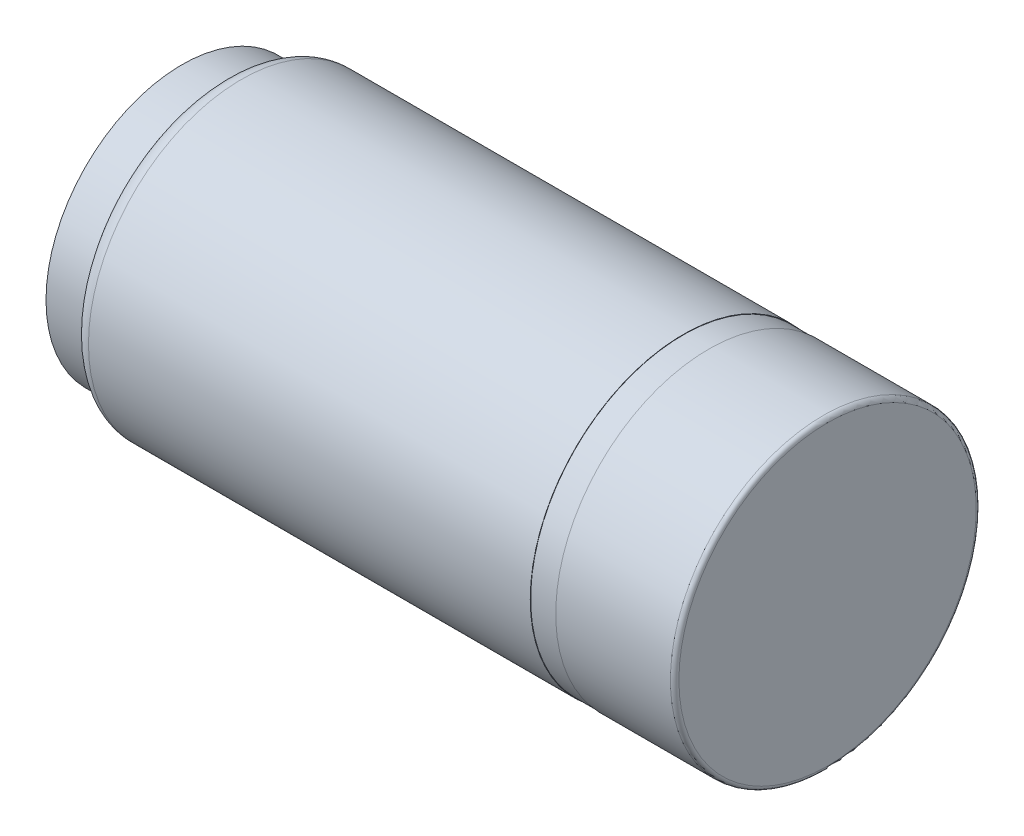
from build123d import *

# Parameters (mm, degrees)
SKETCH_1_W               = 16.3
SKETCH_1_H               = 3
SKETCH_1_W_2             = 5
SKETCH_1_H_2             = 16
SKETCH_19_W              = 3
SKETCH_19_H              = 0.05
EXTRUDE_START            = 14
SKETCH_20_R              = 18
EXTRUDE_2_DEPTH          = 14
CUT_EXTRUDE_6_DEPTH      = 3
CUT_EXTRUDE_4_DEPTH      = 12
SKETCH_13_R              = 1.5
CUT_EXTRUDE_8_DEPTH      = 7
PATTERN_CIRCULAR_2_COUNT = 4
FILLET_1_R               = 0.5
SKETCH_21_R              = 20
CUT_EXTRUDE_7_DEPTH      = 42.3


with BuildPart() as part:
    # Эскиз1 → Повернуть1 основной корпус (revolve)
    with BuildSketch(Plane(origin=(0, 0, 0), x_dir=(1, 0, 0), z_dir=(0, 1, 0)), mode=Mode.PRIVATE) as revolve_1_sk:
        with Locations((8.15, 1.5)):
            Rectangle(SKETCH_1_W, SKETCH_1_H)
        Polygon((16.3, 0), (19.3, 0), (19.3, 10), (16.3, 10), (16.3, 3), align=None)
        Polygon((24.3, 0), (24.3, 16), (20.3, 16), (19.3, 15), (19.3, 10), (19.3, 0), align=None)
        Polygon((40.8, 17.5), (42.3, 16), (42.3, 0), (24.3, 0), (24.3, 16), (25.8, 17.5), align=None)
        with Locations((44.8, 8)):
            Rectangle(SKETCH_1_W_2, SKETCH_1_H_2)
        with BuildLine():
            ThreePointArc((47.3, 16), (47.885786438, 17.414213562), (49.3, 18))
            Line((49.3, 18), (104.3, 18))
            Line((104.3, 18), (104.3, 0))
            Line((104.3, 0), (47.3, 0))
            Line((47.3, 0), (47.3, 16))
        make_face()
    revolve(revolve_1_sk.sketch.rotate(Axis((0, 0, 0), (1, 0, 0)), 180), axis=Axis((0, 0, 0), (1, 0, 0)))

    # Эскиз19 → Вырез-Повернуть2 пластиковая часть (revolve, cut)
    with BuildSketch(Plane(origin=(0, 0, 0), x_dir=(1, 0, 0), z_dir=(0, 1, 0)), mode=Mode.PRIVATE) as cut_revolve_2_sk:
        with Locations((102.8, 17.975)):
            Rectangle(SKETCH_19_W, SKETCH_19_H)
    revolve(cut_revolve_2_sk.sketch.rotate(Axis((103.004702911, 0, 0), (-1, 0, 0)), 180), axis=Axis((103.004702911, 0, 0), (-1, 0, 0)), mode=Mode.SUBTRACT)

    # Эскиз20 → Бобышка-Вытянуть2 пластиковая крышка контактов (add)
    with BuildSketch(Plane(origin=(104.3, 0, 0), x_dir=(0, 0, -1), z_dir=(1, 0, 0)).offset(EXTRUDE_START)):
        with Locations(Location((0, 0, 0), (0, 0, 180))):
            Circle(SKETCH_20_R)
    extrude(amount=-EXTRUDE_2_DEPTH)

    # Эскиз11 → Вырез-Вытянуть6 (cut)
    with BuildSketch(Plane.ZY.offset(-16.3)):
        with BuildLine():
            ThreePointArc((4.358898944, 9), (0, 10), (-4.358898944, 9))
            Line((-4.358898944, 9), (4.358898944, 9))
        make_face()
        with BuildLine():
            Line((4.358898944, -9), (-4.358898944, -9))
            ThreePointArc((-4.358898944, -9), (0, -10), (4.358898944, -9))
        make_face()
    extrude(amount=-CUT_EXTRUDE_6_DEPTH, mode=Mode.SUBTRACT)

    # Эскиз6 → Вырез-Вытянуть4 на оси (cut)
    with BuildSketch(Plane.ZY):
        with BuildLine():
            Line((-1.75306936, 2.434491286), (1.561110291, 2.561822527))
            ThreePointArc((1.561110291, 2.561822527), (-0.115175441, 2.997788288), (-1.75306936, 2.434491286))
        make_face()
    extrude(amount=-CUT_EXTRUDE_4_DEPTH, mode=Mode.SUBTRACT)

    # Эскиз13 → Вырез-Вытянуть8 для винтов (cut)
    with BuildSketch(Plane.ZY.offset(-19.3)):
        with Locations((-9.192388155, 9.192388155)):
            Circle(SKETCH_13_R)
    cut_extrude_8 = extrude(amount=-CUT_EXTRUDE_8_DEPTH, mode=Mode.SUBTRACT)

    # Круговой массив2 для винтов: Вырез-Вытянуть8 для винтов ×4 about axis
    pattern_circular_2_axis = Axis((0, 0, 0), (1, 0, 0))
    for i in range(1, PATTERN_CIRCULAR_2_COUNT):
        add(cut_extrude_8.rotate(pattern_circular_2_axis, i * 360 / PATTERN_CIRCULAR_2_COUNT), mode=Mode.SUBTRACT)

    # Скругление1
    # the kernel refuses this fillet: 0.5 mm, written as the material it takes off along each edge
    with BuildSketch(Plane(origin=(19.3, 0, 0), x_dir=(0, 0, 1), z_dir=(0, 1, 0))) as fillet_1_piece_1:
        with BuildLine():
            CenterArc((15 - FILLET_1_R * 0.414213562373, FILLET_1_R), FILLET_1_R, 270, 45)
            Line((15 - FILLET_1_R * 0.414213562373, 0), (15, 0))
            Line((15, 0), (15 + FILLET_1_R * 0.292893218813, FILLET_1_R * 0.292893218813))
        make_face()
    revolve(axis=Axis((19.3, 0, 0), (1, 0, 0)), mode=Mode.SUBTRACT)
    with BuildSketch(Plane(origin=(118.3, 0, 0), x_dir=(0, 0, 1), z_dir=(0, 1, 0))) as fillet_1_piece_2:
        with BuildLine():
            CenterArc((18 - FILLET_1_R, -FILLET_1_R), FILLET_1_R, 0, 90)
            Line((18 - FILLET_1_R, 0), (18, 0))
            Line((18, 0), (18, -FILLET_1_R))
        make_face()
    revolve(axis=Axis((118.3, 0, 0), (1, 0, 0)), mode=Mode.SUBTRACT)
    with BuildSketch(Plane(origin=(16.001803864, 9, -4.358898944), x_dir=(0, 0, 1), z_dir=(1, 0, 0))) as fillet_1_piece_3:
        with BuildLine():
            CenterArc((0.116258256, 0.5), FILLET_1_R, 243.474647983, 26.525352017)
            ThreePointArc((-0.107038622, 0.052631579), (-0.053597784, 0.026156196), (0, 0))
            Line((0, 0), (0.116258256, 0))
        make_face()
    extrude(amount=3.298196136, mode=Mode.SUBTRACT)
    with BuildSketch(Plane(origin=(16.001803864, 9, 4.358898944), x_dir=(0, -0.4412496727830022, 0.8973843804462464), z_dir=(1, 0, 0))) as fillet_1_piece_4:
        with BuildLine():
            CenterArc((0.116296493, 0.499991108), FILLET_1_R, 243.81635761, 26.525352017)
            Line((-0.104328343, 0.051298918), (0, 0))
            ThreePointArc((0, 0), (0.059639227, -0.000177843), (0.119278454, 0))
        make_face()
    extrude(amount=3.298196136, mode=Mode.SUBTRACT)
    with BuildSketch(Plane(origin=(16.3, 9, -5.608898944), x_dir=(1, 0, 0), z_dir=(0, 0, 1)), Plane(origin=(16.3, -9, 5.608898944), x_dir=(1, 0, 0), z_dir=(0, 0, -1))) as fillet_1_piece_5:
        with BuildLine():
            CenterArc((FILLET_1_R, -FILLET_1_R), FILLET_1_R, 90, 90)
            Line((0, -FILLET_1_R), (0, 0))
            Line((0, 0), (FILLET_1_R, 0))
        make_face()
    extrude(amount=11.217797887, mode=Mode.SUBTRACT)
    with BuildSketch(Plane(origin=(16.001803864, -9, 4.358898944), x_dir=(0, 0.4412496727830018, 0.8973843804462466), z_dir=(1, 0, 0))) as fillet_1_piece_6:
        with BuildLine():
            CenterArc((0.116296493, -0.499991108), FILLET_1_R, 89.658290373, 26.525352017)
            Line((-0.104328343, -0.051298918), (0, 0))
            ThreePointArc((0, 0), (0.059639227, 0.000177843), (0.119278454, 0))
        make_face()
    extrude(amount=3.298196136, mode=Mode.SUBTRACT)
    with BuildSketch(Plane(origin=(16.001803864, -9, -4.358898944), x_dir=(0, 0, 1), z_dir=(1, 0, 0))) as fillet_1_piece_7:
        with BuildLine():
            CenterArc((0.116258256, -0.5), FILLET_1_R, 90, 26.525352017)
            ThreePointArc((-0.107038622, -0.052631579), (-0.053597784, -0.026156196), (0, 0))
            Line((0, 0), (0.116258256, 0))
        make_face()
    extrude(amount=3.298196136, mode=Mode.SUBTRACT)
    with BuildSketch(Plane(origin=(19.3, 9.192388155, -9.192388155), x_dir=(0, 0, 1), z_dir=(0, -1, 0))) as fillet_1_piece_8:
        with BuildLine():
            CenterArc((1.5 + FILLET_1_R, -FILLET_1_R), FILLET_1_R, 90, 90)
            Line((1.5, -FILLET_1_R), (1.5, 0))
            Line((1.5, 0), (1.5 + FILLET_1_R, 0))
        make_face()
    revolve(axis=Axis((19.3, 9.192388155, -9.192388155), (-1, 0, 0)), mode=Mode.SUBTRACT)
    with BuildSketch(Plane(origin=(19.3, -9.192388155, -9.192388155), x_dir=(0, 1, 0), z_dir=(0, 0, 1))) as fillet_1_piece_9:
        with BuildLine():
            CenterArc((1.5 + FILLET_1_R, -FILLET_1_R), FILLET_1_R, 90, 90)
            Line((1.5, -FILLET_1_R), (1.5, 0))
            Line((1.5, 0), (1.5 + FILLET_1_R, 0))
        make_face()
    revolve(axis=Axis((19.3, -9.192388155, -9.192388155), (-1, 0, 0)), mode=Mode.SUBTRACT)
    with BuildSketch(Plane(origin=(19.3, -9.192388155, 9.192388155), x_dir=(0, 0, -1), z_dir=(0, 1, 0))) as fillet_1_piece_10:
        with BuildLine():
            CenterArc((1.5 + FILLET_1_R, -FILLET_1_R), FILLET_1_R, 90, 90)
            Line((1.5, -FILLET_1_R), (1.5, 0))
            Line((1.5, 0), (1.5 + FILLET_1_R, 0))
        make_face()
    revolve(axis=Axis((19.3, -9.192388155, 9.192388155), (-1, 0, 0)), mode=Mode.SUBTRACT)
    with BuildSketch(Plane(origin=(19.3, 9.192388155, 9.192388155), x_dir=(0, -1, 0), z_dir=(0, 0, -1))) as fillet_1_piece_11:
        with BuildLine():
            CenterArc((1.5 + FILLET_1_R, -FILLET_1_R), FILLET_1_R, 90, 90)
            Line((1.5, -FILLET_1_R), (1.5, 0))
            Line((1.5, 0), (1.5 + FILLET_1_R, 0))
        make_face()
    revolve(axis=Axis((19.3, 9.192388155, 9.192388155), (-1, 0, 0)), mode=Mode.SUBTRACT)
    # the kernel refuses this fillet: 0.5 mm, written as the material it adds along each edge
    with BuildSketch(Plane(origin=(19.3, 0, 0), x_dir=(0, -0.8947368421052432, -0.4465937565389121), z_dir=(0, -0.4465937565389121, 0.8947368421052432))) as fillet_1_2_piece_1:
        with BuildLine():
            CenterArc((10 + FILLET_1_R, -FILLET_1_R), FILLET_1_R, 90, 90)
            Line((10, -FILLET_1_R), (10, 0))
            Line((10, 0), (10 + FILLET_1_R, 0))
        make_face()
    revolve(axis=Axis((19.3, 0, 0), (1, 0, 0)), revolution_arc=126.949295967)
    with BuildSketch(Plane(origin=(19.3, 9, -4.242640687), x_dir=(0, 1, 0), z_dir=(0, 0, 1)), Plane(origin=(19.3, -9, 4.242640687), x_dir=(0, -1, 0), z_dir=(0, 0, -1))) as fillet_1_2_piece_2:
        with BuildLine():
            CenterArc((FILLET_1_R, FILLET_1_R), FILLET_1_R, 180, 90)
            Line((0, FILLET_1_R), (0, 0))
            Line((0, 0), (FILLET_1_R, 0))
        make_face()
    extrude(amount=8.485281374)
    with BuildSketch(Plane(origin=(19.3, 0, 0), x_dir=(0, 0.894736842105243, 0.44659375653891253), z_dir=(0, 0.44659375653891253, -0.894736842105243))) as fillet_1_2_piece_3:
        with BuildLine():
            CenterArc((10 + FILLET_1_R, -FILLET_1_R), FILLET_1_R, 90, 90)
            Line((10, -FILLET_1_R), (10, 0))
            Line((10, 0), (10 + FILLET_1_R, 0))
        make_face()
    revolve(axis=Axis((19.3, 0, 0), (1, 0, 0)), revolution_arc=126.949295967)
    with BuildSketch(Plane(origin=(19.3, -8.5, 4.242640687), x_dir=(0, -0.8947368421052433, 0.446593756538912), z_dir=(0, 0.446593756538912, 0.8947368421052433))) as fillet_1_2_piece_4:
        with BuildLine():
            CenterArc((0.5 + FILLET_1_R, -FILLET_1_R), FILLET_1_R, 90, 90)
            Line((0.5, -FILLET_1_R), (0.5, 0))
            Line((0.5, 0), (0.5 + FILLET_1_R, 0))
        make_face()
    revolve(axis=Axis((19.3, -8.5, 4.242640687), (1, 0, 0)), revolution_arc=26.525352017)
    with BuildSketch(Plane(origin=(19.3, -8.5, -4.242640687), x_dir=(0, -1, 0), z_dir=(0, 0, 1))) as fillet_1_2_piece_5:
        with BuildLine():
            CenterArc((0.5 + FILLET_1_R, -FILLET_1_R), FILLET_1_R, 90, 90)
            Line((0.5, -FILLET_1_R), (0.5, 0))
            Line((0.5, 0), (0.5 + FILLET_1_R, 0))
        make_face()
    revolve(axis=Axis((19.3, -8.5, -4.242640687), (1, 0, 0)), revolution_arc=26.525352017)
    with BuildSketch(Plane(origin=(19.3, 8.5, 4.242640687), x_dir=(0, 0.8947368421052433, 0.446593756538912), z_dir=(0, -0.446593756538912, 0.8947368421052433))) as fillet_1_2_piece_6:
        with BuildLine():
            CenterArc((0.5 + FILLET_1_R, FILLET_1_R), FILLET_1_R, 180, 90)
            Line((0.5, FILLET_1_R), (0.5, 0))
            Line((0.5, 0), (0.5 + FILLET_1_R, 0))
        make_face()
    revolve(axis=Axis((19.3, 8.5, 4.242640687), (-1, 0, 0)), revolution_arc=26.525352017)
    with BuildSketch(Plane(origin=(19.3, 8.5, -4.242640687), x_dir=(0, 1, 0), z_dir=(0, 0, 1))) as fillet_1_2_piece_7:
        with BuildLine():
            CenterArc((0.5 + FILLET_1_R, FILLET_1_R), FILLET_1_R, 180, 90)
            Line((0.5, FILLET_1_R), (0.5, 0))
            Line((0.5, 0), (0.5 + FILLET_1_R, 0))
        make_face()
    revolve(axis=Axis((19.3, 8.5, -4.242640687), (-1, 0, 0)), revolution_arc=26.525352017)

    # Эскиз21 → Вырез-Вытянуть7 (cut)
    with BuildSketch(Plane.ZY):
        Circle(SKETCH_21_R)
    extrude(amount=-CUT_EXTRUDE_7_DEPTH, mode=Mode.SUBTRACT)


solid = part.part
